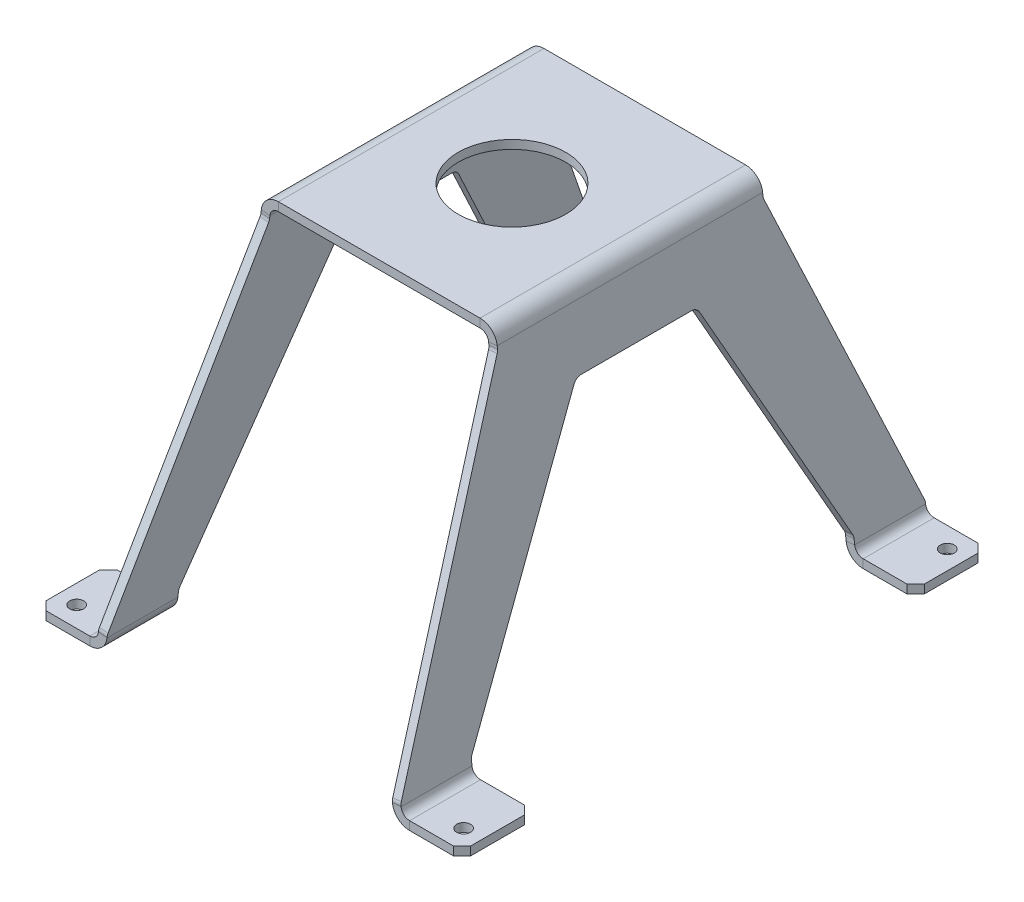
from build123d import *

# Parameters (mm, degrees)
SM_BASE_FLANGE_1_DEPTH   = 61.75
SKETCH_3_R               = 25
CUT_EXTRUDE_1_DEPTH      = 4
EXTRUDE_2_DEPTH          = 4
CUT_EXTRUDE_3_DEPTH      = 4
SM_START                 = -122
SM_EDGE_FLANGE_1_DEPTH   = 244
SM_EDGE_FLANGE_1_2_DEPTH = 33
SM_START_2               = 89
SM_EDGE_FLANGE_1_3_DEPTH = 33
SKETCH_44_R              = 3.25
CUT_EXTRUDE_4_DEPTH      = 4
CHAMFER_1_SIZE           = 4


# Read off the part's stored shape, not the designer's step: Ребро-кромка1
# Sheet-metal steps are written as plain solids
with BuildPart() as part:
    # Sketch 1 → Базовая кромка1 (new, symmetric)
    with BuildSketch(Plane.XY):
        with BuildLine():
            Line((-67.211573407, -134), (-53.127605882, 0))
            Line((-53.127605882, 0), (-50.876471404, 21.418113853))
            ThreePointArc((-50.876471404, 21.418113853), (-49.574906248, 23.972579302), (-46.898383823, 25))
            Line((-46.898383823, 25), (46.898383823, 25))
            ThreePointArc((46.898383823, 25), (49.574906248, 23.972579302), (50.876471404, 21.418113853))
            Line((50.876471404, 21.418113853), (53.127605882, 0))
            Line((53.127605882, 0), (67.211573407, -134))
            Line((67.211573407, -134), (71.189660989, -133.581886147))
            Line((71.189660989, -133.581886147), (57.105693463, 0.418113853))
            Line((57.105693463, 0.418113853), (54.854558986, 21.836227706))
            ThreePointArc((54.854558986, 21.836227706), (52.251428674, 26.945158604), (46.898383823, 29))
            Line((46.898383823, 29), (-46.898383823, 29))
            ThreePointArc((-46.898383823, 29), (-52.251428674, 26.945158604), (-54.854558986, 21.836227706))
            Line((-54.854558986, 21.836227706), (-57.105693463, 0.418113853))
            Line((-57.105693463, 0.418113853), (-71.189660989, -133.581886147))
            Line((-71.189660989, -133.581886147), (-67.211573407, -134))
        make_face()
    extrude(amount=SM_BASE_FLANGE_1_DEPTH, both=True)

    # Эскиз3 → Вытянуть1 (cut)
    with BuildSketch(Plane(origin=(0, 29, 0), x_dir=(1, 0, 0), z_dir=(0, 1, 0))):
        with Locations(Location((0, 0, 0), (0, 0, 180))):
            Circle(SKETCH_3_R)
    extrude(amount=-CUT_EXTRUDE_1_DEPTH, mode=Mode.SUBTRACT)

    # Эскиз33 → Вытянуть2 (add)
    with BuildSketch(Plane(origin=(56.525210635, 5.941039037, 0), x_dir=(0, 0, -1), z_dir=(0.9945218953682734, 0.10452846326765315, 0))):
        with BuildLine():
            Line((-62.05448187, 13.177809809), (-121.69551813, -130.808388804))
            ThreePointArc((-121.69551813, -130.808388804), (-121.923141122, -131.558761245), (-122, -132.339122533))
            Line((-122, -132.339122533), (-122, -140.291456461))
            Line((-122, -140.291456461), (-61.75, -140.291456461))
            Line((-61.75, -140.291456461), (-61.75, 14.708543539))
            ThreePointArc((-61.75, 14.708543539), (-61.826858878, 13.928182251), (-62.05448187, 13.177809809))
        make_face()
        with BuildLine():
            Line((122, -132.339122533), (122, -140.291456461))
            Line((122, -140.291456461), (61.75, -140.291456461))
            Line((61.75, -140.291456461), (61.75, 14.708543539))
            ThreePointArc((61.75, 14.708543539), (61.826858878, 13.928182251), (62.05448187, 13.177809809))
            Line((62.05448187, 13.177809809), (121.69551813, -130.808388804))
            ThreePointArc((121.69551813, -130.808388804), (121.923141122, -131.558761245), (122, -132.339122533))
        make_face()
    extrude_2 = extrude(amount=-EXTRUDE_2_DEPTH)

    # Эскиз39 → Вытянуть3 (cut)
    with BuildSketch(Plane(origin=(56.525210635, 5.941039037, 0), x_dir=(0, 0, -1), z_dir=(0.9945218953682734, 0.10452846326765315, 0))):
        with BuildLine():
            Line((25.655356237, -12.291456461), (-25.655356237, -12.291456461))
            ThreePointArc((-25.655356237, -12.291456461), (-27.73044927, -12.871808979), (-29.20339957, -14.444462008))
            Line((-29.20339957, -14.444462008), (-88.548043333, -128.444462008))
            ThreePointArc((-88.548043333, -128.444462008), (-88.885368279, -129.340712892), (-89, -130.291456461))
            Line((-89, -130.291456461), (-89, -140.291456461))
            Line((-89, -140.291456461), (89, -140.291456461))
            Line((89, -140.291456461), (89, -130.291456461))
            ThreePointArc((89, -130.291456461), (88.885368279, -129.340712892), (88.548043333, -128.444462008))
            Line((88.548043333, -128.444462008), (29.20339957, -14.444462008))
            ThreePointArc((29.20339957, -14.444462008), (27.73044927, -12.871808979), (25.655356237, -12.291456461))
        make_face()
    cut_extrude_3 = extrude(amount=-CUT_EXTRUDE_3_DEPTH, mode=Mode.SUBTRACT)

    # Зеркальное отражение1: Вытянуть2, Вытянуть3 across plane
    add(extrude_2.mirror(Plane(origin=(0, 0, 0), x_dir=(0, 0, 1), z_dir=(1, 0, 0))))
    add(cut_extrude_3.mirror(Plane(origin=(0, 0, 0), x_dir=(0, 0, 1), z_dir=(1, 0, 0))), mode=Mode.SUBTRACT)

    # Ребро-кромка1 outline → Ребро-кромка1 (cut)
    with BuildSketch(Plane.XY.offset(SM_START)):
        with BuildLine():
            Line((71.189660989, -133.581886147), (71.116967081, -132.890249808))
            ThreePointArc((71.116967081, -132.890249808), (67.89872427, -130.284168166), (66.414685062, -126.418113853))
            Line((66.414685062, -126.418113853), (67.211573407, -134))
            Line((67.211573407, -134), (71.189660989, -133.581886147))
        make_face()
        with BuildLine():
            ThreePointArc((-66.414685062, -126.418113853), (-67.89872427, -130.284168166), (-71.116967081, -132.890249808))
            Line((-71.116967081, -132.890249808), (-71.189660989, -133.581886147))
            Line((-71.189660989, -133.581886147), (-67.211573407, -134))
            Line((-67.211573407, -134), (-66.414685062, -126.418113853))
        make_face()
    extrude(amount=SM_EDGE_FLANGE_1_DEPTH, mode=Mode.SUBTRACT)

    # Sm Edge Flange 1 2 outline → Sm Edge Flange 1 2 (add)
    with BuildSketch(Plane.XY.offset(SM_START)):
        with BuildLine():
            ThreePointArc((71.116967081, -132.890249808), (72.707566699, -133.407066953), (74.370860225, -133.581886147))
            Line((74.370860225, -133.581886147), (98.769244048, -133.581886147))
            Line((98.769244048, -133.581886147), (98.769244048, -129.581886147))
            Line((98.769244048, -129.581886147), (74.370860225, -129.581886147))
            ThreePointArc((74.370860225, -129.581886147), (71.694337799, -128.554465449), (70.392772643, -126))
            Line((70.392772643, -126), (71.116967081, -132.890249808))
        make_face()
        with BuildLine():
            Line((-98.769244048, -133.581886147), (-74.370860225, -133.581886147))
            ThreePointArc((-74.370860225, -133.581886147), (-72.707566699, -133.407066953), (-71.116967081, -132.890249808))
            Line((-71.116967081, -132.890249808), (-70.392772643, -126))
            ThreePointArc((-70.392772643, -126), (-71.694337799, -128.554465449), (-74.370860225, -129.581886147))
            Line((-74.370860225, -129.581886147), (-98.769244048, -129.581886147))
            Line((-98.769244048, -129.581886147), (-98.769244048, -133.581886147))
        make_face()
    extrude(amount=SM_EDGE_FLANGE_1_2_DEPTH)

    # Sm Edge Flange 1 3 outline → Sm Edge Flange 1 3 (add)
    with BuildSketch(Plane.XY.offset(SM_START_2)):
        with BuildLine():
            ThreePointArc((71.116967081, -132.890249808), (72.707566699, -133.407066953), (74.370860225, -133.581886147))
            Line((74.370860225, -133.581886147), (98.769244048, -133.581886147))
            Line((98.769244048, -133.581886147), (98.769244048, -129.581886147))
            Line((98.769244048, -129.581886147), (74.370860225, -129.581886147))
            ThreePointArc((74.370860225, -129.581886147), (71.694337799, -128.554465449), (70.392772643, -126))
            Line((70.392772643, -126), (71.116967081, -132.890249808))
        make_face()
        with BuildLine():
            Line((-98.769244048, -133.581886147), (-74.370860225, -133.581886147))
            ThreePointArc((-74.370860225, -133.581886147), (-72.707566699, -133.407066953), (-71.116967081, -132.890249808))
            Line((-71.116967081, -132.890249808), (-70.392772643, -126))
            ThreePointArc((-70.392772643, -126), (-71.694337799, -128.554465449), (-74.370860225, -129.581886147))
            Line((-74.370860225, -129.581886147), (-98.769244048, -129.581886147))
            Line((-98.769244048, -129.581886147), (-98.769244048, -133.581886147))
        make_face()
    extrude(amount=SM_EDGE_FLANGE_1_3_DEPTH)

    # Эскиз44 → Вытянуть4 (cut)
    with BuildSketch(Plane(origin=(0, -129.581886147, 0), x_dir=(1, 0, 0), z_dir=(0, 1, 0))):
        with Locations(Location((90, -112.5, 0), (0, 0, 180))):
            Circle(SKETCH_44_R)
        with Locations(Location((90, 112.5, 0), (0, 0, 180))):
            Circle(SKETCH_44_R)
        with Locations(Location((-90, 112.5, 0), (0, 0, 180))):
            Circle(SKETCH_44_R)
        with Locations(Location((-90, -112.5, 0), (0, 0, 180))):
            Circle(SKETCH_44_R)
    extrude(amount=-CUT_EXTRUDE_4_DEPTH, mode=Mode.SUBTRACT)

    # Фаска1
    chamfer_1_edges = [part.edges().sort_by_distance(p)[0] for p in [
        (98.769244048, -131.581886147, 122),
        (98.769244048, -131.581886147, 89),
        (-98.769244048, -131.581886147, 89),
        (-98.769244048, -131.581886147, 122),
        (98.769244048, -131.581886147, -89),
        (98.769244048, -131.581886147, -122),
        (-98.769244048, -131.581886147, -122),
        (-98.769244048, -131.581886147, -89),
    ]]
    chamfer(chamfer_1_edges, length=CHAMFER_1_SIZE)


solid = part.part
